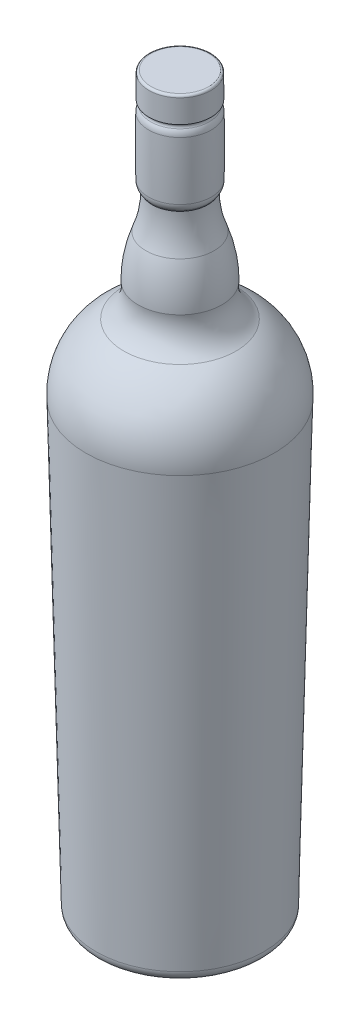
from build123d import *

# Parameters (mm, degrees)
FILLET1_R = 5
FILLET2_R = 5
FILLET3_R = 1
FILLET4_R = 5


# Read off the part's stored shape, not the designer's step: Shell2
with BuildPart() as part:
    # Sketch1 → Revolve1 (revolve)
    with BuildSketch(Plane.XY, mode=Mode.PRIVATE) as revolve1_sk:
        with BuildLine():
            Line((905.205998229, 55.291025129), (942.931413391, 55.291025129))
            Line((942.931413391, 55.291025129), (947.607730062, 256.972458171))
            ThreePointArc((947.607730062, 256.972458171), (943.566903445, 275.081946804), (930.501504315, 288.25681697))
            ThreePointArc((930.501504315, 288.25681697), (925.125521395, 294.717998181), (924.028878356, 303.05139059))
            ThreePointArc((924.028878356, 303.05139059), (923.153292748, 312.895480238), (920.560772542, 322.432334548))
            ThreePointArc((920.560772542, 322.432334548), (918.321093309, 330.576863672), (917.758997126, 339.005004961))
            ThreePointArc((917.758997126, 339.005004961), (918.319336987, 339.834749552), (919.236524099, 340.236277439))
            ThreePointArc((919.236524099, 340.236277439), (919.436680318, 355.661055591), (919.236524099, 371.085833742))
            ThreePointArc((919.236524099, 371.085833742), (918.136371488, 372.428808232), (919.165370574, 373.82704896))
            Line((919.165370574, 373.82704896), (919.165370574, 385.291025129))
            Line((919.165370574, 385.291025129), (905.205998229, 385.291025129))
            Line((905.205998229, 385.291025129), (905.205998229, 55.291025129))
        make_face()
    revolve(revolve1_sk.sketch.rotate(Axis((905.205998229, 385.291025129, 0), (0, -1, 0)), 90), axis=Axis((905.205998229, 385.291025129, 0), (0, -1, 0)))

    # Fillet1
    fillet1_edges = [part.edges().sort_by_distance(p)[0] for p in [
        (905.205998229, 55.291025129, -37.725415162),
    ]]
    fillet(fillet1_edges, radius=FILLET1_R)

    # Fillet2
    fillet2_edges = [part.edges().sort_by_distance(p)[0] for p in [
        (905.205998229, 340.236277439, -14.03052587),
        (905.205998229, 371.085833742, -14.03052587),
    ]]
    fillet(fillet2_edges, radius=FILLET2_R)

    # Fillet3
    fillet3_edges = [part.edges().sort_by_distance(p)[0] for p in [
        (905.205998229, 385.291025129, -13.959372344),
    ]]
    fillet(fillet3_edges, radius=FILLET3_R)

    # Sketch5 → Cut-Revolve1 (revolve, cut)
    with BuildSketch(Plane.XY):
        with BuildLine():
            Line((905.205998229, 65.291025129), (905.205998229, 15.291025129))
            ThreePointArc((905.205998229, 15.291025129), (930.205998229, 40.291025129), (905.205998229, 65.291025129))
        make_face()
    revolve(axis=Axis((905.205998229, 15.291025129, 0), (0, 1, 0)), mode=Mode.SUBTRACT)

    # Fillet4
    fillet4_edges = [part.edges().sort_by_distance(p)[0] for p in [
        (885.205998229, 55.291025129, 0),
    ]]
    fillet(fillet4_edges, radius=FILLET4_R)

    # Shell2 outline → Shell2 (revolve, cut)
    with BuildSketch(Plane(origin=(905.205998229, 0, 0), x_dir=(1, 0, 0), z_dir=(0, 0, 1))):
        with BuildLine():
            ThreePointArc((20.86996779, 58.957691795), (21.544183194, 58.46528327), (22.360679775, 58.291025129))
            Line((22.360679775, 58.291025129), (32.840004537, 58.291025129))
            ThreePointArc((32.840004537, 58.291025129), (34.237730963, 58.860514437), (34.839467133, 60.24466429))
            Line((34.839467133, 60.24466429), (39.403894875, 257.100521731))
            ThreePointArc((39.403894875, 257.100521731), (35.713073699, 273.671219236), (23.728555088, 285.695423594))
            ThreePointArc((23.728555088, 285.695423594), (17.247945658, 293.342256432), (15.822374209, 303.263954729))
            ThreePointArc((15.822374209, 303.263954729), (14.977281296, 312.461113556), (12.548349187, 321.371904842))
            ThreePointArc((12.548349187, 321.371904842), (10.128415763, 330.248285805), (9.567031047, 339.431480454))
            ThreePointArc((9.567031047, 339.431480454), (9.955929531, 340.564959038), (10.613556209, 341.566728913))
            ThreePointArc((10.613556209, 341.566728913), (10.960788914, 342.152618702), (11.091290454, 342.821054745))
            ThreePointArc((11.091290454, 342.821054745), (11.230657984, 355.829915293), (11.083862327, 368.838694141))
            ThreePointArc((11.083862327, 368.838694141), (10.985455484, 369.415286635), (10.724437, 369.938748344))
            ThreePointArc((10.724437, 369.938748344), (9.934130791, 372.658837185), (10.959372344, 375.299357393))
            Line((10.959372344, 375.299357393), (10.959372344, 382.291025129))
            Line((10.959372344, 382.291025129), (0, 382.291025129))
            Line((0, 382.291025129), (0, 68.291025129))
            ThreePointArc((0, 68.291025129), (11.43095214, 65.851411143), (20.86996779, 58.957691795))
        make_face()
    revolve(axis=Axis((905.205998229, 0, 0), (0, 1, 0)), mode=Mode.SUBTRACT)


with BuildPart() as body_2:
    # Sketch6 → Revolve2 (revolve)
    with BuildSketch(Plane.XY, mode=Mode.PRIVATE) as revolve2_sk:
        with BuildLine():
            Line((905.205998229, 303.270607144), (905.205998229, 68.391025129))
            ThreePointArc((905.205998229, 68.391025129), (916.65870323, 65.951218974), (926.122626725, 59.055476956))
            ThreePointArc((926.122626725, 59.055476956), (926.796215586, 58.564676812), (927.611354732, 58.391025129))
            Line((927.611354732, 58.391025129), (937.948294554, 58.391025129))
            ThreePointArc((937.948294554, 58.391025129), (939.34602098, 58.960514437), (939.94775715, 60.34466429))
            Line((939.94775715, 60.34466429), (944.509966332, 257.104839064))
            ThreePointArc((944.509966332, 257.104839064), (940.830869203, 273.624087222), (928.882574195, 285.609893903))
            ThreePointArc((928.882574195, 285.609893903), (922.365065832, 293.296079876), (920.928341834, 303.270607144))
            Line((920.928341834, 303.270607144), (905.205998229, 303.270607144))
        make_face()
    revolve(revolve2_sk.sketch.rotate(Axis((905.205998229, 385.291025129, 0), (0, -1, 0)), 90), axis=Axis((905.205998229, 385.291025129, 0), (0, -1, 0)))


solid = Compound([part.part, body_2.part])
